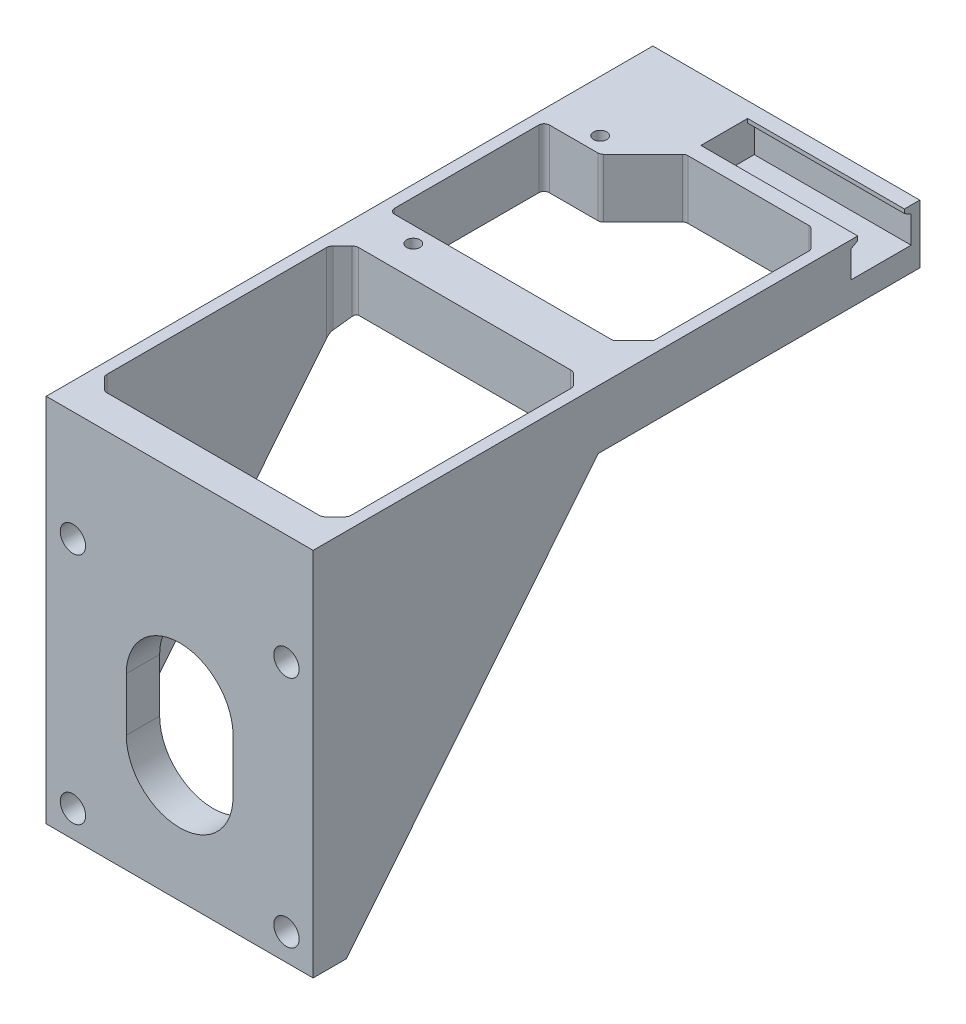
from build123d import *
from OCP.BRepFilletAPI import BRepFilletAPI_MakeChamfer

# Parameters (mm, degrees)
BOSS_EXTRUDE1_START      = -1
SKETCH1_W                = 1.7
SKETCH1_H                = 89.2
BOSS_EXTRUDE1_DEPTH      = 8.8
SKETCH4_W                = 40
SKETCH4_H                = 11.6
BOSS_EXTRUDE3_DEPTH      = 8.8
SERVO_HOLDER_DEPTH       = 1
SERVO_HOLDER_DEPTH_BACK  = 8.8
SKETCH3_W                = 14
SKETCH3_H                = 7
SKETCH3_R                = 1
SKETCH37_W               = 26
SKETCH37_H               = 7
BOSS_EXTRUDE19_DEPTH     = 9.8
CUT_EXTRUDE10_DEPTH      = 93.434679639
CUT_EXTRUDE10_DEPTH_BACK = 93.434679639
SKETCH29_W               = 49.101454262
SKETCH29_H               = 6.377389624
BOSS_EXTRUDE17_DEPTH     = 3
SKETCH39_W               = 1.7
SKETCH39_H               = 41.2
BOSS_EXTRUDE20_DEPTH     = 8.8
CUT_EXTRUDE13_DEPTH      = 23.5
CHAMFER2_SIZE            = 0.6
CHAMFER2_SIZE_2          = 1.039230485
CHAMFER3_SIZE            = 3
CHAMFER4_SIZE            = 2.5
CUT_EXTRUDE16_DEPTH      = 10
FILLET11_R               = 0.8
SKETCH51_W               = 40
SKETCH51_H               = 41
CUT_EXTRUDE17_DEPTH      = 10
SKETCH50_W               = 40
SKETCH50_H               = 55.5
SKETCH50_R               = 1.9
BOSS_EXTRUDE24_DEPTH     = 5
SKETCH53_W               = 1.7
SKETCH53_H               = 37.711538462
BOSS_EXTRUDE25_DEPTH     = 8.8
CHAMFER6_SIZE            = 37.709072194
CHAMFER6_SIZE_2          = 46.7
CHAMFER5_SIZE            = 2
FILLET13_R               = 1


# Some blends are built 0.0001 mm under size
with BuildPart() as part:
    # Sketch1 → Boss-Extrude1 (new body)
    with BuildSketch(Plane(origin=(0, 0, 0), x_dir=(1, 0, 0), z_dir=(0, 1, 0)).offset(BOSS_EXTRUDE1_START)):
        with Locations((-20.85, 25.311538462)):
            Rectangle(SKETCH1_W, SKETCH1_H)
    extrude(amount=-BOSS_EXTRUDE1_DEPTH)

    # Sketch4 → Boss-Extrude3 (add)
    with BuildSketch(Plane.XZ.offset(9.8)):
        with Locations((-1.7, -64.111538462)):
            Rectangle(SKETCH4_W, SKETCH4_H)
    extrude(amount=-BOSS_EXTRUDE3_DEPTH)

    # Sketch3 → Servo Holder (add, two sides: drawn at the far end of the back side and taken through both)
    # profile 1 of 2: a face of its own
    with BuildSketch(Plane.XZ.offset(9.8).offset(-SERVO_HOLDER_DEPTH_BACK)):
        with Locations((-14.7, -55.411538462)):
            Rectangle(SKETCH3_W, SKETCH3_H)
        with Locations(Location((-14, -54.311538462, 0), (0, 0, 270))):
            Circle(SKETCH3_R, mode=Mode.SUBTRACT)
    # profile 2 of 2: a face of its own
    with BuildSketch(Plane.XZ.offset(9.8).offset(-SERVO_HOLDER_DEPTH_BACK)):
        with Locations((-14.7, -25.211538462)):
            Rectangle(SKETCH3_W, SKETCH3_H)
        with Locations(Location((-14, -26.311538462, 0), (0, 0, 90))):
            Circle(SKETCH3_R, mode=Mode.SUBTRACT)
    extrude(amount=SERVO_HOLDER_DEPTH + SERVO_HOLDER_DEPTH_BACK)

    # Sketch37 → Boss-Extrude19 (add)
    with BuildSketch(Plane(origin=(0, -1, 0), x_dir=(1, 0, 0), z_dir=(0, 1, 0))):
        with Locations((5.3, 25.211538462)):
            Rectangle(SKETCH37_W, SKETCH37_H)
    extrude(amount=-BOSS_EXTRUDE19_DEPTH)

    # Sketch29 → Cut-Extrude10 (cut, two sides: drawn at the far end of the back side and taken through both)
    with BuildSketch(Plane(origin=(0, 0, -69.911538462), x_dir=(-1, 0, 0), z_dir=(0, 0, -1)).offset(-CUT_EXTRUDE10_DEPTH_BACK)):
        with Locations((-2.850727131, -12.988694812)):
            Rectangle(SKETCH29_W, SKETCH29_H)
    extrude(amount=CUT_EXTRUDE10_DEPTH + CUT_EXTRUDE10_DEPTH_BACK, mode=Mode.SUBTRACT)

    # Sketch35 → Boss-Extrude17 (add)
    with BuildSketch(Plane(origin=(18.3, 0, 0), x_dir=(0, 0, -1), z_dir=(1, 0, 0))):
        Polygon((-2, -1), (21.711538462, -1), (21.711538462, -9.8), (-19.288461538, -9.8), (-19.288461538, -1), align=None)
    extrude(amount=-BOSS_EXTRUDE17_DEPTH)

    # Sketch39 → Boss-Extrude20 (add)
    with BuildSketch(Plane(origin=(0, -1, 0), x_dir=(1, 0, 0), z_dir=(0, 1, 0))):
        with Locations((17.45, 49.311538462)):
            Rectangle(SKETCH39_W, SKETCH39_H)
    extrude(amount=-BOSS_EXTRUDE20_DEPTH)

    # Sketch40 → Cut-Extrude13 (cut)
    with BuildSketch(Plane(origin=(18.3, 0, 0), x_dir=(0, 0, -1), z_dir=(1, 0, 0))):
        Polygon((64.111538462, -1), (60.611538462, -1), (60.611538462, -2.2), (59.611538462, -2.2), (59.611538462, -6.2), (64.111538462, -6.2), align=None)
        Polygon((67.611538462, -1), (64.111538462, -1), (64.111538462, -6.2), (68.611538462, -6.2), (68.611538462, -2.2), (67.611538462, -2.2), align=None)
    extrude(amount=-CUT_EXTRUDE13_DEPTH, mode=Mode.SUBTRACT)

    # Chamfer2
    # the kernel refuses this chamfer: 1.039230485, 0.6 mm, written as the material it takes off along each edge
    with BuildSketch(Plane(origin=(20.988578382, -2.2, -60.611538462), x_dir=(0, 0.9983227437537925, -0.05789386240267317), z_dir=(-1, 0, 0))) as chamfer2_piece_1_section:
        Polygon((CHAMFER2_SIZE * 0.998322743754, -CHAMFER2_SIZE * 0.0578938624027), (-CHAMFER2_SIZE_2 * 0.0578938623771, -CHAMFER2_SIZE_2 * 0.998322743313), (0, 0), align=None)
    chamfer2_piece_1 = extrude(amount=26.188578382, mode=Mode.PRIVATE)
    chamfer2_piece_1 = split(chamfer2_piece_1, bisect_by=Plane(origin=(7.894289191, -2.005782009, -59.611538462), z_dir=(0, 0, -1)), keep=Keep.TOP, mode=Mode.PRIVATE)
    add(chamfer2_piece_1, mode=Mode.SUBTRACT)
    with BuildSketch(Plane(origin=(20.988578382, -2.2, -67.611538462), x_dir=(0, 0.9983227437537925, 0.05789386240267317), z_dir=(-1, 0, 0))) as chamfer2_piece_2_section:
        Polygon((CHAMFER2_SIZE * 0.998322743754, CHAMFER2_SIZE * 0.0578938624027), (-CHAMFER2_SIZE_2 * 0.0578938623771, CHAMFER2_SIZE_2 * 0.998322743313), (0, 0), align=None)
    chamfer2_piece_2 = extrude(amount=26.188578382, mode=Mode.PRIVATE)
    chamfer2_piece_2 = split(chamfer2_piece_2, bisect_by=Plane(origin=(7.894289191, -2.005782009, -68.611538462), z_dir=(0, 0, 1)), keep=Keep.TOP, mode=Mode.PRIVATE)
    add(chamfer2_piece_2, mode=Mode.SUBTRACT)

    # Chamfer3
    chamfer3_edges = [part.edges().sort_by_distance(p)[0] for p in [
        (16.6, -5.4, -58.311538462),
        (16.6, -5.4, -28.711538462),
    ]]
    chamfer(chamfer3_edges, length=CHAMFER3_SIZE)

    # Chamfer4
    chamfer4_edges = [part.edges().sort_by_distance(p)[0] for p in [
        (-7.7, -5.4, -58.311538462),
    ]]
    chamfer(chamfer4_edges, length=CHAMFER4_SIZE)

    # Sketch43 → Cut-Extrude16 (cut)
    with BuildSketch(Plane(origin=(0, -1, 0), x_dir=(1, 0, 0), z_dir=(0, 1, 0))):
        Polygon((-5.2, 58.311538462), (-11.6, 51.911538462), (-5.2, 51.911538462), align=None)
    extrude(amount=-CUT_EXTRUDE16_DEPTH, mode=Mode.SUBTRACT)

    # Fillet11
    fillet11_edges = [part.edges().sort_by_distance(p)[0] for p in [
        (16.6, -5.4, -55.311538462),
        (16.6, -5.4, -31.711538462),
        (13.6, -5.4, -28.711538462),
        (13.6, -5.4, -58.311538462),
        (-5.2, -5.4, -58.311538462),
        (-11.6, -5.4, -51.911538462),
        (-20, -5.4, -51.911538462),
        (-20, -5.4, -28.711538462),
    ]]
    fillet(fillet11_edges, radius=FILLET11_R)

    # Sketch51 → Cut-Extrude17 (cut)
    with BuildSketch(Plane(origin=(0, -1, 0), x_dir=(1, 0, 0), z_dir=(0, 1, 0))):
        with Locations((-1.7, 1.211538462)):
            Rectangle(SKETCH51_W, SKETCH51_H)
    extrude(amount=-CUT_EXTRUDE17_DEPTH, mode=Mode.SUBTRACT)



with BuildPart() as body_2:
    # Sketch50 → Boss-Extrude24 (new body)
    with BuildSketch(Plane.XY.offset(16)):
        with Locations((-1.7, -28.75)):
            Rectangle(SKETCH50_W, SKETCH50_H)
        with Locations((-17.7, -17.5)):
            Circle(SKETCH50_R, mode=Mode.SUBTRACT)
        with Locations(Location((14.3, -17.5, 0), (0, 0, 180))):
            Circle(SKETCH50_R, mode=Mode.SUBTRACT)
        with Locations((14.3, -52.5)):
            Circle(SKETCH50_R, mode=Mode.SUBTRACT)
        with Locations(Location((-17.7, -52.5, 0), (0, 0, 180))):
            Circle(SKETCH50_R, mode=Mode.SUBTRACT)
        with BuildLine():
            Line((6.3, -31), (6.3, -39))
            ThreePointArc((6.3, -39), (-1.7, -47), (-9.7, -39))
            Line((-9.7, -39), (-9.7, -31))
            ThreePointArc((-9.7, -31), (-1.7, -23), (6.3, -31))
        make_face(mode=Mode.SUBTRACT)
    extrude(amount=BOSS_EXTRUDE24_DEPTH)


with BuildPart() as part_1:
    add(part.part)

    add(body_2.part)  # Boss-Extrude25 merges body 2
    # Sketch53 → Boss-Extrude25 (add)
    with BuildSketch(Plane(origin=(0, -1, 0), x_dir=(1, 0, 0), z_dir=(0, 1, 0))):
        with Locations((17.45, 2.855769231)):
            Rectangle(SKETCH53_W, SKETCH53_H)
        with Locations((-20.85, 2.855769231)):
            Rectangle(SKETCH53_W, SKETCH53_H)
    extrude(amount=-BOSS_EXTRUDE25_DEPTH)

    # Chamfer6
    chamfer6_edges_1 = [part_1.edges().sort_by_distance(p)[0] for p in [
        (17.45, -9.8, 16),
    ]]
    chamfer6_side_1 = [part_1.faces().sort_by_distance(p)[0] for p in [
        (17.45, -9.8, 15.245818556),
    ]]
    chamfer6_edges_2 = [part_1.edges().sort_by_distance(p)[0] for p in [
        (-20.85, -9.8, 16),
    ]]
    chamfer6_side_2 = [part_1.faces().sort_by_distance(p)[0] for p in [
        (-20.85, -9.8, 15.245818556),
    ]]
    chamfer6 = BRepFilletAPI_MakeChamfer(part_1.part.solid().wrapped)
    for e in chamfer6_edges_1:
        chamfer6.Add(CHAMFER6_SIZE - 0.0001, CHAMFER6_SIZE_2 - 0.0001, e.wrapped, chamfer6_side_1[0].wrapped)
    for e in chamfer6_edges_2:
        chamfer6.Add(CHAMFER6_SIZE - 0.0001, CHAMFER6_SIZE_2 - 0.0001, e.wrapped, chamfer6_side_2[0].wrapped)
    add(Compound.cast(chamfer6.Shape()), mode=Mode.REPLACE)  # a hair under: the kernel refuses the full size

    # Chamfer5
    # the kernel refuses this chamfer: 2 mm, written as the material it adds along each edge
    with BuildSketch(Plane(origin=(16.6, -1, -21.711538462), x_dir=(0.027495876610585647, 0, 0.9996219169112968), z_dir=(0, -1, 0))) as chamfer5_piece_1_section:
        Polygon((CHAMFER5_SIZE * 0.999621916911, CHAMFER5_SIZE * 0.0274958766106), (-CHAMFER5_SIZE * 0.0274958766106, CHAMFER5_SIZE * 0.999621916911), (0, 0), align=None)
    chamfer5_piece_1 = extrude(amount=8.8, mode=Mode.PRIVATE)
    chamfer5_piece_1 = split(chamfer5_piece_1, bisect_by=Plane(origin=(15.940558744, -7.457267814, -23.600668383), z_dir=(0, 0.6282344833325636, 0.7780240574377293)), keep=Keep.TOP, mode=Mode.PRIVATE)
    add(chamfer5_piece_1)
    with BuildSketch(Plane(origin=(16.6, -1, -21.711538462), x_dir=(0.027495876610585647, 0, 0.9996219169112968), z_dir=(0, -1, 0))) as chamfer5_piece_2_section:
        Polygon((CHAMFER5_SIZE * 0.999621916911, CHAMFER5_SIZE * 0.0274958766106), (-CHAMFER5_SIZE * 0.0274958766106, CHAMFER5_SIZE * 0.999621916911), (0, 0), align=None)
    chamfer5_piece_2 = extrude(amount=8.8, mode=Mode.PRIVATE)
    chamfer5_piece_2 = split(chamfer5_piece_2, bisect_by=Plane(origin=(15.205194682, -9.762152332, -21.739533216), z_dir=(0, -0.6282344833325636, -0.7780240574377293)), keep=Keep.TOP, mode=Mode.PRIVATE)
    add(chamfer5_piece_2)
    with BuildSketch(Plane(origin=(16.6, -1, -21.711538462), x_dir=(0.027495876610585647, 0, 0.9996219169112968), z_dir=(0, -1, 0))) as chamfer5_piece_3_section:
        Polygon((CHAMFER5_SIZE * 0.999621916911, CHAMFER5_SIZE * 0.0274958766106), (-CHAMFER5_SIZE * 0.0274958766106, CHAMFER5_SIZE * 0.999621916911), (0, 0), align=None)
    chamfer5_piece_3 = extrude(amount=13.943365976, mode=Mode.PRIVATE)
    chamfer5_piece_3 = split(chamfer5_piece_3, bisect_by=Plane(origin=(16.145077407, -9.8, -20.667672286), z_dir=(0, -1, 0)), keep=Keep.TOP, mode=Mode.PRIVATE)
    chamfer5_piece_3 = split(chamfer5_piece_3, bisect_by=Plane(origin=(16.145077407, -10.6992723, -20.982832863), z_dir=(0, 0.6282344833325636, 0.7780240574377293)), keep=Keep.TOP, mode=Mode.PRIVATE)
    add(chamfer5_piece_3)
    with BuildSketch(Plane(origin=(16.6, -61.643265976, 16), x_dir=(-0.9996219169112968, 0, 0.027495876610585623), z_dir=(0, 1, 0))) as chamfer5_piece_4_section:
        Polygon((CHAMFER5_SIZE * 0.999621916911, -CHAMFER5_SIZE * 0.0274958766106), (-CHAMFER5_SIZE * 0.0274958766106, -CHAMFER5_SIZE * 0.999621916911), (0, 0), align=None)
    chamfer5_piece_4 = extrude(amount=60.643265976, mode=Mode.PRIVATE)
    chamfer5_piece_4 = split(chamfer5_piece_4, bisect_by=Plane(origin=(15.9626445, -38.896337805, 1.785574758), z_dir=(0, 0.6282344833325636, 0.7780240574377293)), keep=Keep.TOP, mode=Mode.PRIVATE)
    chamfer5_piece_4 = split(chamfer5_piece_4, bisect_by=Plane(origin=(15.9626445, -56.5, 15.333023777), z_dir=(0, 1, 0)), keep=Keep.TOP, mode=Mode.PRIVATE)
    chamfer5_piece_4 = chamfer5_piece_4 - Plane(origin=(14.3, -52.5, 15.333023777), x_dir=(1, 0, 0), z_dir=(0, 0, -1)) * Cylinder(1.9, 130, mode=Mode.PRIVATE)
    chamfer5_piece_4 = chamfer5_piece_4 - Plane(origin=(14.3, -17.5, 15.333023777), x_dir=(-1, 0, 0), z_dir=(0, 0, -1)) * Cylinder(1.9, 130, mode=Mode.PRIVATE)
    add(chamfer5_piece_4)
    with BuildSketch(Plane(origin=(-20, -1, 16), x_dir=(0.9996219169112968, 0, 0.027495876610585647), z_dir=(0, -1, 0))) as chamfer5_piece_5_section:
        Polygon((CHAMFER5_SIZE * 0.999621916911, -CHAMFER5_SIZE * 0.0274958766106), (-CHAMFER5_SIZE * 0.0274958766106, -CHAMFER5_SIZE * 0.999621916911), (0, 0), align=None)
    chamfer5_piece_5 = extrude(amount=60.643265976, mode=Mode.PRIVATE)
    chamfer5_piece_5 = split(chamfer5_piece_5, bisect_by=Plane(origin=(-19.362644591, -38.896335996, 1.785573298), z_dir=(0, 0.6282344833325636, 0.7780240574377292)), keep=Keep.TOP, mode=Mode.PRIVATE)
    chamfer5_piece_5 = split(chamfer5_piece_5, bisect_by=Plane(origin=(-19.362644591, -56.5, 15.333023677), z_dir=(0, 1, 0)), keep=Keep.TOP, mode=Mode.PRIVATE)
    chamfer5_piece_5 = chamfer5_piece_5 - Plane(origin=(-17.7, -52.5, 15.333023677), x_dir=(-1, 0, 0), z_dir=(0, 0, -1)) * Cylinder(1.9, 130, mode=Mode.PRIVATE)
    chamfer5_piece_5 = chamfer5_piece_5 - Plane(origin=(-17.7, -17.5, 15.333023677), x_dir=(1, 0, 0), z_dir=(0, 0, -1)) * Cylinder(1.9, 130, mode=Mode.PRIVATE)
    add(chamfer5_piece_5)
    with BuildSketch(Plane(origin=(-20, -1, -21.711538462), x_dir=(0.9996219169112968, 0, -0.0274958766105856), z_dir=(0, -1, 0))) as chamfer5_piece_6_section:
        Polygon((CHAMFER5_SIZE * 0.999621916911, CHAMFER5_SIZE * 0.0274958766106), (-CHAMFER5_SIZE * 0.0274958766106, CHAMFER5_SIZE * 0.999621916911), (0, 0), align=None)
    chamfer5_piece_6 = extrude(amount=8.8, mode=Mode.PRIVATE)
    chamfer5_piece_6 = split(chamfer5_piece_6, bisect_by=Plane(origin=(-19.340558744, -7.457267814, -23.600668383), z_dir=(0, 0.6282344833325636, 0.7780240574377292)), keep=Keep.TOP, mode=Mode.PRIVATE)
    add(chamfer5_piece_6)
    with BuildSketch(Plane(origin=(-20, -1, -21.711538462), x_dir=(0.9996219169112968, 0, -0.0274958766105856), z_dir=(0, -1, 0))) as chamfer5_piece_7_section:
        Polygon((CHAMFER5_SIZE * 0.999621916911, CHAMFER5_SIZE * 0.0274958766106), (-CHAMFER5_SIZE * 0.0274958766106, CHAMFER5_SIZE * 0.999621916911), (0, 0), align=None)
    chamfer5_piece_7 = extrude(amount=13.943365976, mode=Mode.PRIVATE)
    chamfer5_piece_7 = split(chamfer5_piece_7, bisect_by=Plane(origin=(-19.545077407, -9.8, -20.667672286), z_dir=(0, -1, 0)), keep=Keep.TOP, mode=Mode.PRIVATE)
    chamfer5_piece_7 = split(chamfer5_piece_7, bisect_by=Plane(origin=(-19.545077407, -10.6992723, -20.982832863), z_dir=(0, 0.6282344833325636, 0.7780240574377292)), keep=Keep.TOP, mode=Mode.PRIVATE)
    add(chamfer5_piece_7)
    with BuildSketch(Plane(origin=(-20, -1, -21.711538462), x_dir=(0.9996219169112968, 0, -0.0274958766105856), z_dir=(0, -1, 0))) as chamfer5_piece_8_section:
        Polygon((CHAMFER5_SIZE * 0.999621916911, CHAMFER5_SIZE * 0.0274958766106), (-CHAMFER5_SIZE * 0.0274958766106, CHAMFER5_SIZE * 0.999621916911), (0, 0), align=None)
    chamfer5_piece_8 = extrude(amount=8.8, mode=Mode.PRIVATE)
    chamfer5_piece_8 = split(chamfer5_piece_8, bisect_by=Plane(origin=(-18.605194682, -9.762152332, -21.739533216), z_dir=(0, -0.6282344833325636, -0.7780240574377292)), keep=Keep.TOP, mode=Mode.PRIVATE)
    add(chamfer5_piece_8)

    # Fillet13
    # the kernel refuses this fillet: 1 mm, written as the material it adds along each edge
    with BuildSketch(Plane(origin=(16.6, -55.058575096, 14), x_dir=(0, 0, -1), z_dir=(0, 1, 0))) as fillet13_piece_1_section:
        with BuildLine():
            CenterArc((FILLET13_R * 0.414213562373, FILLET13_R), FILLET13_R, 225, 45)
            Line((-FILLET13_R * 0.292893218813, FILLET13_R * 0.292893218813), (0, 0))
            Line((0, 0), (FILLET13_R * 0.414213562373, 0))
        make_face()
    fillet13_piece_1 = extrude(amount=54.058575096, mode=Mode.PRIVATE)
    fillet13_piece_1 = split(fillet13_piece_1, bisect_by=Plane(origin=(16.537950877, -37.953464011, 1.024228339), z_dir=(0, 0.6282344833326955, 0.7780240574376227)), keep=Keep.TOP, mode=Mode.PRIVATE)
    add(fillet13_piece_1)
    with BuildSketch(Plane(origin=(14.6, -16.659367602, 16), x_dir=(0.7071067811862666, 0, -0.7071067811868285), z_dir=(0, 1, 0))) as fillet13_piece_2_section:
        with BuildLine():
            CenterArc((FILLET13_R * 0.414213562373, FILLET13_R), FILLET13_R, 225, 45)
            Line((-FILLET13_R * 0.292893218813, FILLET13_R * 0.292893218814), (0, 0))
            Line((0, 0), (FILLET13_R * 0.414213562373, 0))
        make_face()
    fillet13_piece_2 = extrude(amount=15.659367602, mode=Mode.PRIVATE)
    fillet13_piece_2 = fillet13_piece_2 - Plane(origin=(14.3, -17.5, 15.93807593), x_dir=(-1, 0, 0), z_dir=(0, 0, -1)) * Cylinder(1.9, 33, mode=Mode.PRIVATE)
    add(fillet13_piece_2)
    with BuildSketch(Plane(origin=(16.6, -13.309214575, -19.711538462), x_dir=(-0.7071067811868306, 0, -0.7071067811862645), z_dir=(0, 1, 0))) as fillet13_piece_3_section:
        with BuildLine():
            CenterArc((FILLET13_R * 0.414213562373, FILLET13_R), FILLET13_R, 225, 45)
            Line((-FILLET13_R * 0.292893218814, FILLET13_R * 0.292893218814), (0, 0))
            Line((0, 0), (FILLET13_R * 0.414213562373, 0))
        make_face()
    fillet13_piece_3 = extrude(amount=12.309214575, mode=Mode.PRIVATE)
    fillet13_piece_3 = split(fillet13_piece_3, bisect_by=Plane(origin=(16.539310025, -8.886151888, -22.44688112), z_dir=(0, 0.6282344833326955, 0.7780240574376227)), keep=Keep.TOP, mode=Mode.PRIVATE)
    add(fillet13_piece_3)
    with BuildSketch(Plane(origin=(14.6, -1, -21.711538462), x_dir=(-1.0, 0, -3.0276843699474774e-12), z_dir=(0, -1, 0))) as fillet13_piece_4_section:
        with BuildLine():
            CenterArc((FILLET13_R * 0.41421356237, -FILLET13_R), FILLET13_R, 90, 45)
            Line((-FILLET13_R * 0.292893218815, -FILLET13_R * 0.292893218812), (0, 0))
            Line((0, 0), (FILLET13_R * 0.414213562373, 0))
        make_face()
    fillet13_piece_4 = extrude(amount=8.8, mode=Mode.PRIVATE)
    fillet13_piece_4 = split(fillet13_piece_4, bisect_by=Plane(origin=(14.574467182, -7.164487701, -23.837080819), z_dir=(0, 0.6282344833326955, 0.7780240574376227)), keep=Keep.TOP, mode=Mode.PRIVATE)
    add(fillet13_piece_4)
    with BuildSketch(Plane(origin=(14.6, -1, -21.711538462), x_dir=(-1.0, 0, -3.0276843699474774e-12), z_dir=(0, -1, 0))) as fillet13_piece_5_section:
        with BuildLine():
            CenterArc((FILLET13_R * 0.41421356237, -FILLET13_R), FILLET13_R, 90, 45)
            Line((-FILLET13_R * 0.292893218815, -FILLET13_R * 0.292893218812), (0, 0))
            Line((0, 0), (FILLET13_R * 0.414213562373, 0))
        make_face()
    fillet13_piece_5 = extrude(amount=9.835533906, mode=Mode.PRIVATE)
    fillet13_piece_5 = split(fillet13_piece_5, bisect_by=Plane(origin=(14.731074395, -9.8, -21.56358461), z_dir=(0, -1, 0)), keep=Keep.TOP, mode=Mode.PRIVATE)
    fillet13_piece_5 = split(fillet13_piece_5, bisect_by=Plane(origin=(14.731074395, -9.925557513, -21.60758772), z_dir=(0, 0.6282344833326955, 0.7780240574376227)), keep=Keep.TOP, mode=Mode.PRIVATE)
    add(fillet13_piece_5)
    with BuildSketch(Plane(origin=(14.6, -1, -21.711538462), x_dir=(-1.0, 0, -3.0276843699474774e-12), z_dir=(0, -1, 0))) as fillet13_piece_6_section:
        with BuildLine():
            CenterArc((FILLET13_R * 0.41421356237, -FILLET13_R), FILLET13_R, 90, 45)
            Line((-FILLET13_R * 0.292893218815, -FILLET13_R * 0.292893218812), (0, 0))
            Line((0, 0), (FILLET13_R * 0.414213562373, 0))
        make_face()
    fillet13_piece_6 = extrude(amount=8.8, mode=Mode.PRIVATE)
    fillet13_piece_6 = split(fillet13_piece_6, bisect_by=Plane(origin=(14.401050879, -9.787051161, -21.71942805), z_dir=(0, -0.6282344833326955, -0.7780240574376227)), keep=Keep.TOP, mode=Mode.PRIVATE)
    add(fillet13_piece_6)
    with BuildSketch(Plane(origin=(-18, -9.8, -21.711538462), x_dir=(-0.7071067811862645, 0, 0.7071067811868306), z_dir=(0, 1, 0))) as fillet13_piece_7_section:
        with BuildLine():
            CenterArc((FILLET13_R * 0.414213562373, FILLET13_R), FILLET13_R, 225, 45)
            Line((-FILLET13_R * 0.292893218814, FILLET13_R * 0.292893218814), (0, 0))
            Line((0, 0), (FILLET13_R * 0.414213562373, 0))
        make_face()
    fillet13_piece_7 = extrude(amount=8.8, mode=Mode.PRIVATE)
    fillet13_piece_7 = split(fillet13_piece_7, bisect_by=Plane(origin=(-17.801050877, -9.787051161, -21.719428049), z_dir=(0, -0.6282344833326955, -0.7780240574376227)), keep=Keep.TOP, mode=Mode.PRIVATE)
    add(fillet13_piece_7)
    with BuildSketch(Plane(origin=(-18, -10.835533906, -21.711538462), x_dir=(-0.7071067811862645, 0, 0.7071067811868306), z_dir=(0, 1, 0))) as fillet13_piece_8_section:
        with BuildLine():
            CenterArc((FILLET13_R * 0.414213562373, FILLET13_R), FILLET13_R, 225, 45)
            Line((-FILLET13_R * 0.292893218814, FILLET13_R * 0.292893218814), (0, 0))
            Line((0, 0), (FILLET13_R * 0.414213562373, 0))
        make_face()
    fillet13_piece_8 = extrude(amount=9.835533906, mode=Mode.PRIVATE)
    fillet13_piece_8 = split(fillet13_piece_8, bisect_by=Plane(origin=(-18.131074399, -9.8, -21.563584609), z_dir=(0, -1, 0)), keep=Keep.TOP, mode=Mode.PRIVATE)
    fillet13_piece_8 = split(fillet13_piece_8, bisect_by=Plane(origin=(-18.131074399, -9.925557514, -21.607587719), z_dir=(0, 0.6282344833326955, 0.7780240574376227)), keep=Keep.TOP, mode=Mode.PRIVATE)
    add(fillet13_piece_8)
    with BuildSketch(Plane(origin=(-18, -9.8, -21.711538462), x_dir=(-0.7071067811862645, 0, 0.7071067811868306), z_dir=(0, 1, 0))) as fillet13_piece_9_section:
        with BuildLine():
            CenterArc((FILLET13_R * 0.414213562373, FILLET13_R), FILLET13_R, 225, 45)
            Line((-FILLET13_R * 0.292893218814, FILLET13_R * 0.292893218814), (0, 0))
            Line((0, 0), (FILLET13_R * 0.414213562373, 0))
        make_face()
    fillet13_piece_9 = extrude(amount=8.8, mode=Mode.PRIVATE)
    fillet13_piece_9 = split(fillet13_piece_9, bisect_by=Plane(origin=(-17.974467182, -7.164487702, -23.837080819), z_dir=(0, 0.6282344833326955, 0.7780240574376227)), keep=Keep.TOP, mode=Mode.PRIVATE)
    add(fillet13_piece_9)
    with BuildSketch(Plane(origin=(-20, -1, -19.711538462), x_dir=(0.7071067811862645, 0, -0.7071067811868306), z_dir=(0, -1, 0))) as fillet13_piece_10_section:
        with BuildLine():
            CenterArc((FILLET13_R * 0.414213562373, FILLET13_R), FILLET13_R, 225, 45)
            Line((-FILLET13_R * 0.292893218813, FILLET13_R * 0.292893218813), (0, 0))
            Line((0, 0), (FILLET13_R * 0.414213562373, 0))
        make_face()
    fillet13_piece_10 = extrude(amount=12.309214575, mode=Mode.PRIVATE)
    fillet13_piece_10 = split(fillet13_piece_10, bisect_by=Plane(origin=(-19.939310025, -8.886151888, -22.44688112), z_dir=(0, 0.6282344833326955, 0.7780240574376227)), keep=Keep.TOP, mode=Mode.PRIVATE)
    add(fillet13_piece_10)
    with BuildSketch(Plane(origin=(-18, -1, 16), x_dir=(-0.7071067811862667, 0, -0.7071067811868285), z_dir=(0, -1, 0))) as fillet13_piece_11_section:
        with BuildLine():
            CenterArc((FILLET13_R * 0.414213562373, FILLET13_R), FILLET13_R, 225, 45)
            Line((-FILLET13_R * 0.292893218814, FILLET13_R * 0.292893218814), (0, 0))
            Line((0, 0), (FILLET13_R * 0.414213562373, 0))
        make_face()
    fillet13_piece_11 = extrude(amount=15.659367602, mode=Mode.PRIVATE)
    fillet13_piece_11 = fillet13_piece_11 - Plane(origin=(-17.7, -17.5, 15.938075915), x_dir=(1, 0, 0), z_dir=(0, 0, -1)) * Cylinder(1.9, 33, mode=Mode.PRIVATE)
    add(fillet13_piece_11)
    with BuildSketch(Plane(origin=(-20, -1, 14), x_dir=(0.7071067811862645, 0, 0.7071067811868306), z_dir=(0, -1, 0))) as fillet13_piece_12_section:
        with BuildLine():
            CenterArc((FILLET13_R * 0.414213562373, -FILLET13_R), FILLET13_R, 90, 45)
            Line((-FILLET13_R * 0.292893218813, -FILLET13_R * 0.292893218813), (0, 0))
            Line((0, 0), (FILLET13_R * 0.414213562373, 0))
        make_face()
    fillet13_piece_12 = extrude(amount=54.058575096, mode=Mode.PRIVATE)
    fillet13_piece_12 = split(fillet13_piece_12, bisect_by=Plane(origin=(-19.937950877, -37.953464011, 1.024228339), z_dir=(0, 0.6282344833326955, 0.7780240574376227)), keep=Keep.TOP, mode=Mode.PRIVATE)
    add(fillet13_piece_12)
    with BuildSketch(Plane(origin=(-18, -53.340632398, 16), x_dir=(-0.7071067811862645, 0, -0.7071067811868306), z_dir=(0, -1, 0))) as fillet13_piece_13_section:
        with BuildLine():
            CenterArc((FILLET13_R * 0.414213562373, FILLET13_R), FILLET13_R, 225, 45)
            Line((-FILLET13_R * 0.292893218814, FILLET13_R * 0.292893218814), (0, 0))
            Line((0, 0), (FILLET13_R * 0.414213562373, 0))
        make_face()
    fillet13_piece_13 = extrude(amount=4.194801508, mode=Mode.PRIVATE)
    fillet13_piece_13 = fillet13_piece_13 - Plane(origin=(-17.7, -52.5, 15.940638952), x_dir=(-1, 0, 0), z_dir=(0, 0, -1)) * Cylinder(1.9, 11, mode=Mode.PRIVATE)
    fillet13_piece_13 = split(fillet13_piece_13, bisect_by=Plane(origin=(-17.970170366, -55.804263886, 15.438291669), z_dir=(0, 0.6282344833326955, 0.7780240574376227)), keep=Keep.TOP, mode=Mode.PRIVATE)
    fillet13_piece_13 = split(fillet13_piece_13, bisect_by=Plane(origin=(-17.970170366, -56.5, 15.940638952), z_dir=(0, 1, 0)), keep=Keep.TOP, mode=Mode.PRIVATE)
    add(fillet13_piece_13)
    with BuildSketch(Plane(origin=(-18, -18.340632398, 16), x_dir=(-0.7071067811862645, 0, -0.7071067811868306), z_dir=(0, -1, 0))) as fillet13_piece_14_section:
        with BuildLine():
            CenterArc((FILLET13_R * 0.414213562373, FILLET13_R), FILLET13_R, 225, 45)
            Line((-FILLET13_R * 0.292893218814, FILLET13_R * 0.292893218814), (0, 0))
            Line((0, 0), (FILLET13_R * 0.414213562373, 0))
        make_face()
    fillet13_piece_14 = extrude(amount=33.318735204, mode=Mode.PRIVATE)
    fillet13_piece_14 = fillet13_piece_14 - Plane(origin=(-17.7, -52.5, 15.938083204), x_dir=(-1, 0, 0), z_dir=(0, 0, -1)) * Cylinder(1.9, 69, mode=Mode.PRIVATE)
    fillet13_piece_14 = fillet13_piece_14 - Plane(origin=(-17.7, -17.5, 15.938083204), x_dir=(1, 0, 0), z_dir=(0, 0, -1)) * Cylinder(1.9, 69, mode=Mode.PRIVATE)
    add(fillet13_piece_14)
    with BuildSketch(Plane(origin=(14.6, -57.535433906, 16), x_dir=(0.7071067811862666, 0, -0.7071067811868285), z_dir=(0, 1, 0))) as fillet13_piece_15_section:
        with BuildLine():
            CenterArc((FILLET13_R * 0.414213562373, FILLET13_R), FILLET13_R, 225, 45)
            Line((-FILLET13_R * 0.292893218813, FILLET13_R * 0.292893218814), (0, 0))
            Line((0, 0), (FILLET13_R * 0.414213562373, 0))
        make_face()
    fillet13_piece_15 = extrude(amount=4.194801508, mode=Mode.PRIVATE)
    fillet13_piece_15 = split(fillet13_piece_15, bisect_by=Plane(origin=(14.57017034, -55.80426349, 15.438291349), z_dir=(0, 0.6282344833326955, 0.7780240574376227)), keep=Keep.TOP, mode=Mode.PRIVATE)
    fillet13_piece_15 = fillet13_piece_15 - Plane(origin=(14.3, -52.5, 15.940638936), x_dir=(1, 0, 0), z_dir=(0, 0, -1)) * Cylinder(1.9, 11, mode=Mode.PRIVATE)
    fillet13_piece_15 = split(fillet13_piece_15, bisect_by=Plane(origin=(14.57017034, -56.5, 15.940638936), z_dir=(0, 1, 0)), keep=Keep.TOP, mode=Mode.PRIVATE)
    add(fillet13_piece_15)
    with BuildSketch(Plane(origin=(14.6, -51.659367602, 16), x_dir=(0.7071067811862666, 0, -0.7071067811868285), z_dir=(0, 1, 0))) as fillet13_piece_16_section:
        with BuildLine():
            CenterArc((FILLET13_R * 0.414213562373, FILLET13_R), FILLET13_R, 225, 45)
            Line((-FILLET13_R * 0.292893218813, FILLET13_R * 0.292893218814), (0, 0))
            Line((0, 0), (FILLET13_R * 0.414213562373, 0))
        make_face()
    fillet13_piece_16 = extrude(amount=33.318735204, mode=Mode.PRIVATE)
    fillet13_piece_16 = fillet13_piece_16 - Plane(origin=(14.3, -17.5, 15.938083204), x_dir=(-1, 0, 0), z_dir=(0, 0, -1)) * Cylinder(1.9, 69, mode=Mode.PRIVATE)
    fillet13_piece_16 = fillet13_piece_16 - Plane(origin=(14.3, -52.5, 15.938083204), x_dir=(1, 0, 0), z_dir=(0, 0, -1)) * Cylinder(1.9, 69, mode=Mode.PRIVATE)
    add(fillet13_piece_16)


solid = part_1.part
